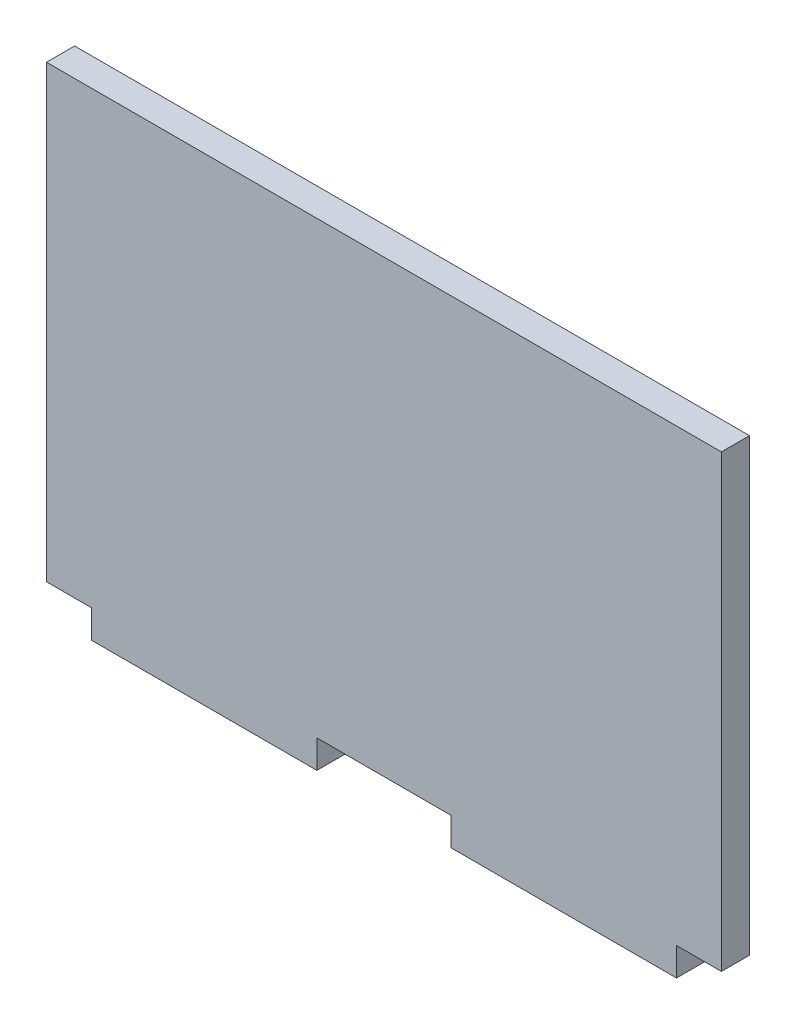
from build123d import *

# Parameters (mm, degrees)
BOSS_EXTRUDE1_DEPTH = 6.35


with BuildPart() as part:
    # Sketch1 → Boss-Extrude1 (new body)
    with BuildSketch(Plane.XY):
        Polygon((73.606662525, 76.198106362), (-78.793337475, 76.198106362), (-78.793337475, -25.401893638), (-68.658315464, -25.401893638), (-68.658315464, -31.751893638), (-17.731576967, -31.751893638), (-17.731576967, -25.401893638), (12.544902016, -25.401893638), (12.544902016, -31.751893638), (63.471640514, -31.751893638), (63.471640514, -25.401893638), (73.606662525, -25.401893638), align=None)
    extrude(amount=BOSS_EXTRUDE1_DEPTH)


solid = part.part
